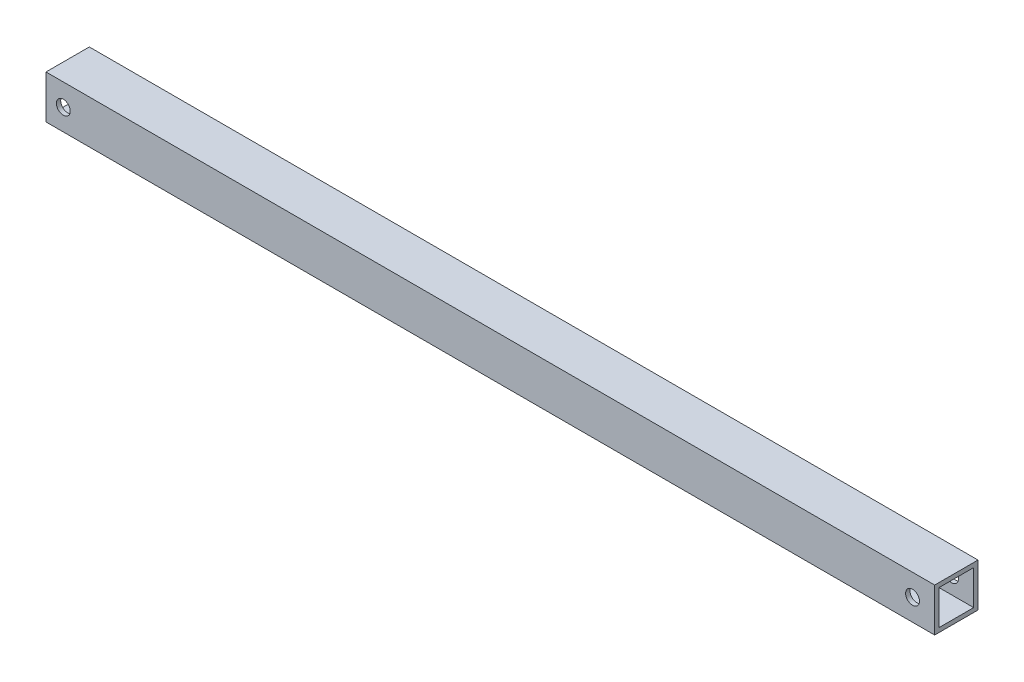
from build123d import *

# Parameters (mm, degrees)
EXTRUDE_1_OUTLINE_W = 205.142153086
EXTRUDE_1_OUTLINE_H = 10
EXTRUDE_1_OUTLINE_R = 1.6
EXTRUDE_1_DEPTH     = 10
SKETCH_2_W          = 8
SKETCH_2_H          = 8
CUT_EXTRUDE_1_DEPTH = 509.807744608


# Read off the part's stored shape, not the designer's step: ﾎﾞｽ - 押し出し1
with BuildPart() as part:
    # ﾎﾞｽ - 押し出し1 outline → ﾎﾞｽ - 押し出し1 (new body)
    with BuildSketch(Plane.XY):
        with Locations((-463.850063806, 460.512640001)):
            Rectangle(EXTRUDE_1_OUTLINE_W, EXTRUDE_1_OUTLINE_H)
        with Locations((-562.425033807, 460.4565023)):
            Circle(EXTRUDE_1_OUTLINE_R, mode=Mode.SUBTRACT)
        with Locations((-366.384636001, 460.512640001)):
            Circle(EXTRUDE_1_OUTLINE_R, mode=Mode.SUBTRACT)
    extrude(amount=EXTRUDE_1_DEPTH)

    # ｽｹｯﾁ2 → ｶｯﾄ - 押し出し1 (cut, through all)
    with BuildSketch(Plane.ZY.offset(566.421140349)):
        with Locations((5, 460.5)):
            Rectangle(SKETCH_2_W, SKETCH_2_H)
    extrude(amount=-CUT_EXTRUDE_1_DEPTH, mode=Mode.SUBTRACT)


solid = part.part
